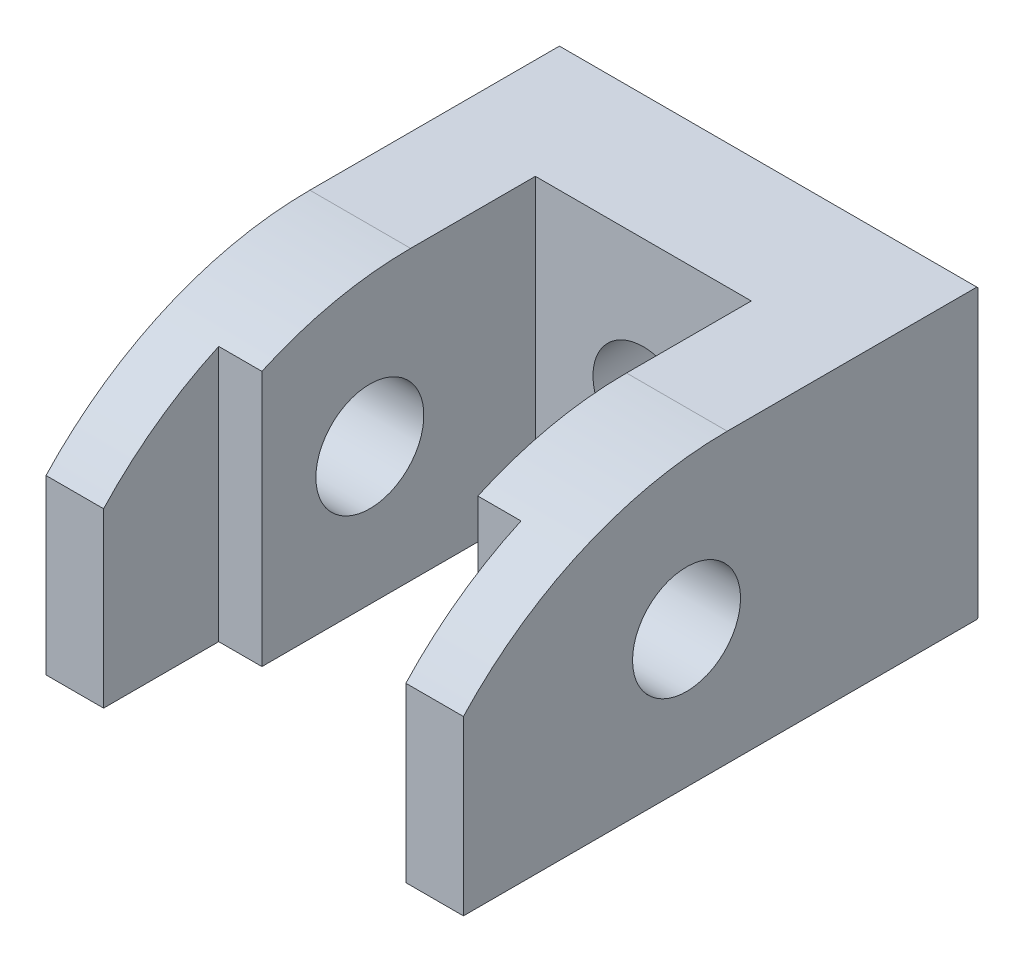
from build123d import *

# Parameters (mm, degrees)
SKETCH2_R           = 7.5
BOSS_EXTRUDE1_DEPTH = 58
CUT_EXTRUDE1_DEPTH  = 107.60206377
DRAFT2_ANGLE        = 45
SKETCH6_R           = 7
CUT_EXTRUDE6_DEPTH  = 107.60206377
CHAMFER9_SIZE       = 8.5
CHAMFER10_SIZE      = 8.5


with BuildPart() as part:
    # Sketch2 → Boss-Extrude1 (new body)
    with BuildSketch(Plane(origin=(0, 0, 0), x_dir=(0, 0, -1), z_dir=(1, 0, 0))):
        with BuildLine():
            Line((0, 0), (0, 24))
            ThreePointArc((0, 24), (16.66060556, 35.82575695), (36.66060556, 40))
            Line((36.66060556, 40), (65, 40))
            Line((65, 40), (80, 31.339745962))
            Line((80, 31.339745962), (80, 8.660254038))
            Line((80, 8.660254038), (65, 0))
            Line((65, 0), (0, 0))
        make_face()
        with Locations((31, 19)):
            Circle(SKETCH2_R, mode=Mode.SUBTRACT)
    extrude(amount=BOSS_EXTRUDE1_DEPTH)

    # Sketch4 → Cut-Extrude1 (cut, through all)
    with BuildSketch(Plane.XZ):
        Polygon((8, 0), (50, 0), (50, -16), (44, -16), (44, -54), (14, -54), (14, -16), (8, -16), align=None)
    extrude(amount=-CUT_EXTRUDE1_DEPTH, mode=Mode.SUBTRACT)

    # Draft2
    draft2_faces = [part.faces().sort_by_distance(p)[0] for p in [
        (29, 4.330127019, -72.5),
        (29, 35.669872981, -72.5),
    ]]
    draft(draft2_faces, Plane(origin=(58, 8.660254038, -80), x_dir=(-1, 0, 0), z_dir=(0, 0, -1)), DRAFT2_ANGLE)

    # Sketch6 → Cut-Extrude6 (cut, through all)
    with BuildSketch(Plane(origin=(0, 0, -80), x_dir=(-1, 0, 0), z_dir=(0, 0, -1))):
        with Locations((-29, 20)):
            Circle(SKETCH6_R)
    extrude(amount=-CUT_EXTRUDE6_DEPTH, mode=Mode.SUBTRACT)

    # Chamfer9
    chamfer9_edges = [part.edges().sort_by_distance(p)[0] for p in [
        (58, 20, -80),
    ]]
    chamfer(chamfer9_edges, length=CHAMFER9_SIZE)

    # Chamfer10
    chamfer10_edges = [part.edges().sort_by_distance(p)[0] for p in [
        (0, 20, -80),
    ]]
    chamfer(chamfer10_edges, length=CHAMFER10_SIZE)


solid = part.part
